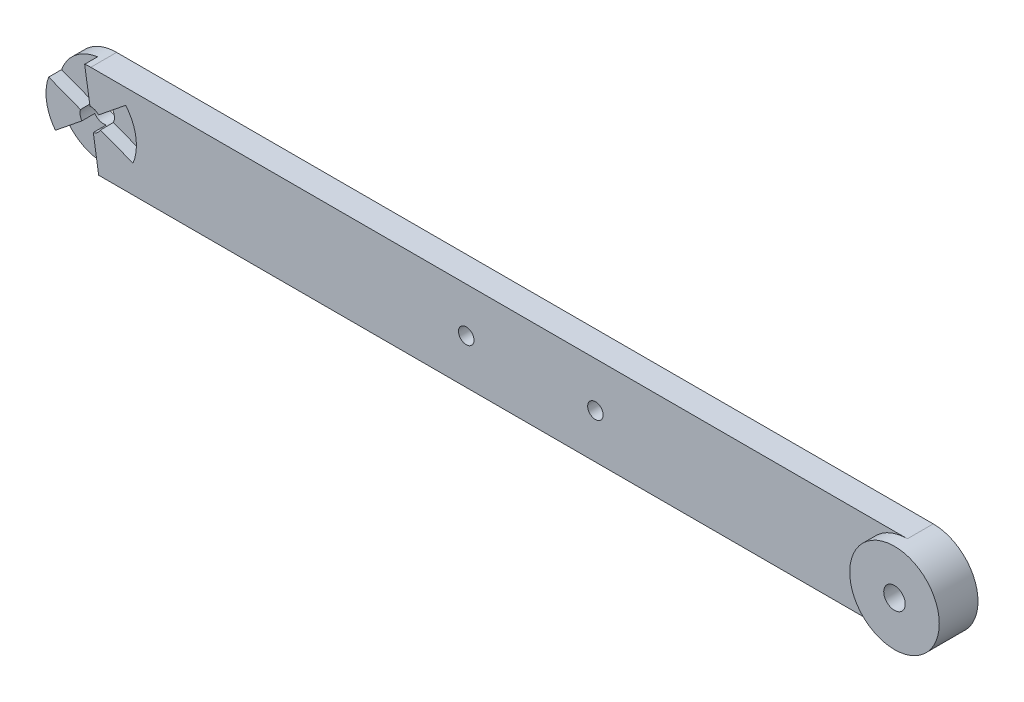
from build123d import *
from build123d.topology import SkipClean

# Parameters (mm, degrees)
SKETCH1_R            = 2.5
BOSS_EXTRUDE1_DEPTH  = 6
CUT_EXTRUDE3_DEPTH   = 3
BOSS_EXTRUDE2_START  = 3
SKETCH4_R            = 2.5
BOSS_EXTRUDE2_DEPTH  = 3
M3_CLEARANCE_HOLE1_D = 3.6


with BuildPart() as part:
    # Sketch1 → Boss-Extrude1 (new body)
    with BuildSketch(Plane.XY):
        with BuildLine():
            Line((0, -10.4), (189.7, -10.4))
            ThreePointArc((189.7, -10.4), (200.1, 0), (189.7, 10.4))
            Line((189.7, 10.4), (0, 10.4))
            ThreePointArc((0, 10.4), (-10.4, 0), (0, -10.4))
        make_face()
        Circle(SKETCH1_R, mode=Mode.SUBTRACT)
        with Locations((189.7, 0)):
            Circle(SKETCH1_R, mode=Mode.SUBTRACT)
    extrude(amount=BOSS_EXTRUDE1_DEPTH)

    # Sketch6 → Cut-Extrude3 (cut)
    with BuildSketch(Plane(origin=(0, 0, 0), x_dir=(-1, 0, 0), z_dir=(0, 0, -1))):
        with BuildLine():
            ThreePointArc((0.189684667, 2.492793559), (1.571265552, 1.944511395), (2.39740304, 0.708843186))
            Line((2.39740304, 0.708843186), (9.962077265, 3.621742201))
            ThreePointArc((9.962077265, 3.621742201), (6.66216594, 8.244728315), (1.449377234, 10.500443116))
            Line((1.449377234, 10.500443116), (0.189684667, 2.492793559))
        make_face()
        with BuildLine():
            ThreePointArc((2.063980215, -1.41066852), (0.89836349, -2.333011582), (-0.584825314, -2.430633529))
            Line((-0.584825314, -2.430633529), (-1.844517881, -10.438283086))
            ThreePointArc((-1.844517881, -10.438283086), (3.809061198, -9.891969106), (8.368961872, -6.505419062))
            Line((8.368961872, -6.505419062), (2.063980215, -1.41066852))
        make_face()
        with BuildLine():
            Line((-9.818339107, -3.995024054), (-2.253664882, -1.082125039))
            ThreePointArc((-2.253664882, -1.082125039), (-2.469629042, 0.388500187), (-1.812577726, 1.721790343))
            Line((-1.812577726, 1.721790343), (-8.117559384, 6.816540886))
            ThreePointArc((-8.117559384, 6.816540886), (-10.471227138, 1.647240791), (-9.818339107, -3.995024054))
        make_face()
    extrude(amount=-CUT_EXTRUDE3_DEPTH, mode=Mode.SUBTRACT)

    # Sketch4 → Boss-Extrude2 (add)
    with SkipClean():  # the faces are left unmerged after this step: merging them gives an invalid solid
        with BuildSketch(Plane(origin=(0, 0, 0), x_dir=(-1, 0, 0), z_dir=(0, 0, -1)).offset(BOSS_EXTRUDE2_START)):
            with BuildLine():
                ThreePointArc((-189.7, 10.4), (-200.1, 0), (-189.7, -10.4))
                ThreePointArc((-189.7, -10.4), (-179.3, 0), (-189.7, 10.4))
            make_face()
            with Locations((-189.7, 0)):
                Circle(SKETCH4_R, mode=Mode.SUBTRACT)
        extrude(amount=-BOSS_EXTRUDE2_DEPTH)


with BuildPart() as body_2:
    # Mirror1: mirrored copy
    add(part.part.mirror(Plane.XY))

    # M3 Clearance Hole1 (through all)
    with Locations(Plane(origin=(0, 0, -6), x_dir=(-1, 0, 0), z_dir=(0, 0, -1))):
        with Locations((-117.224103079, -0.052328238), (-87.224194355, 0)):
            Hole(M3_CLEARANCE_HOLE1_D / 2)


solid = body_2.part
